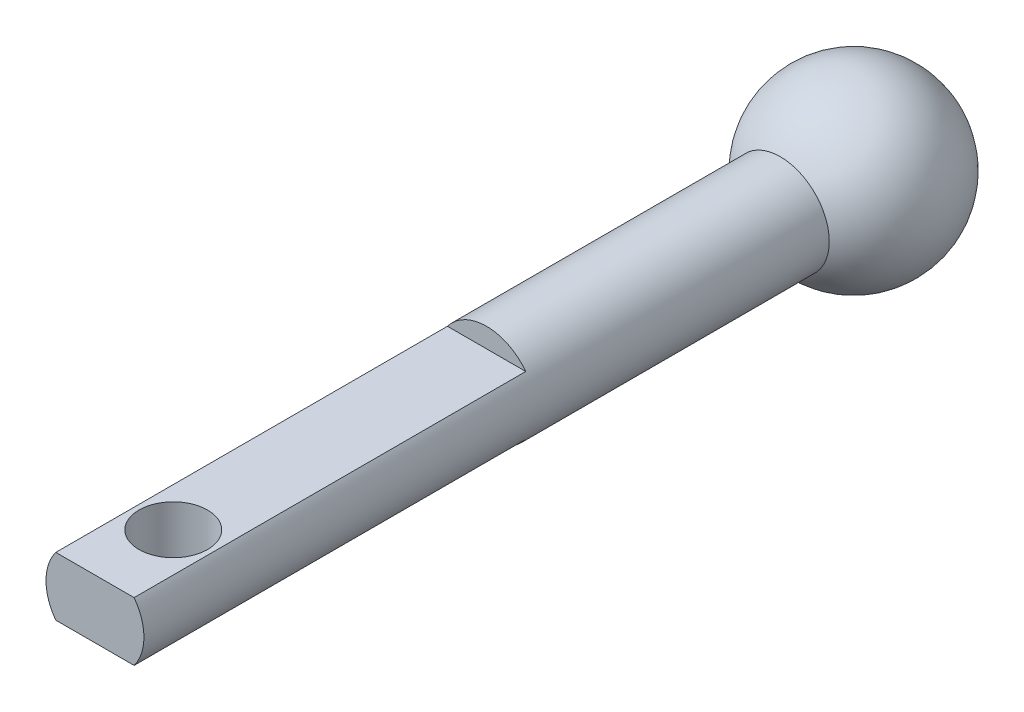
from build123d import *

# Parameters (mm, degrees)
CUT_EXTRUDE3_START      = -20
CUT_EXTRUDE3_DEPTH      = 20
CUT_EXTRUDE4_DEPTH      = 44.707447118
CUT_EXTRUDE4_DEPTH_BACK = 44.707447118
SKETCH4_R               = 1.75


with BuildPart() as part:
    # Sketch1 → Revolve1 (revolve)
    with BuildSketch(Plane(origin=(0, 0, 0), x_dir=(1, 0, 0), z_dir=(0, 1, 0))):
        with BuildLine():
            Line((0, 43.241657387), (0, 0))
            Line((0, 0), (2.5, 0))
            Line((2.5, 0), (2.5, 35))
            ThreePointArc((2.5, 35), (4.30624304, 40.047900427), (0, 43.241657387))
        make_face()
    revolve(axis=Axis((0, 0, -43.241657387), (0, 0, 1)))

    # Sketch2 → Cut-Extrude3 (cut)
    with BuildSketch(Plane.XY.offset(CUT_EXTRUDE3_START)):
        with BuildLine():
            ThreePointArc((2, 1.5), (0, 2.5), (-2, 1.5))
            Line((-2, 1.5), (2, 1.5))
        make_face()
        with BuildLine():
            Line((2, -1.5), (-2, -1.5))
            ThreePointArc((-2, -1.5), (0, -2.5), (2, -1.5))
        make_face()
    extrude(amount=CUT_EXTRUDE3_DEPTH, mode=Mode.SUBTRACT)

    # Sketch4 → Cut-Extrude4 (cut, two sides: drawn at the far end of the back side and taken through both)
    with BuildSketch(Plane(origin=(0, 0, 0), x_dir=(1, 0, 0), z_dir=(0, 1, 0)).offset(-CUT_EXTRUDE4_DEPTH_BACK)):
        with Locations((0, 4)):
            Circle(SKETCH4_R)
    extrude(amount=CUT_EXTRUDE4_DEPTH + CUT_EXTRUDE4_DEPTH_BACK, mode=Mode.SUBTRACT)


solid = part.part
